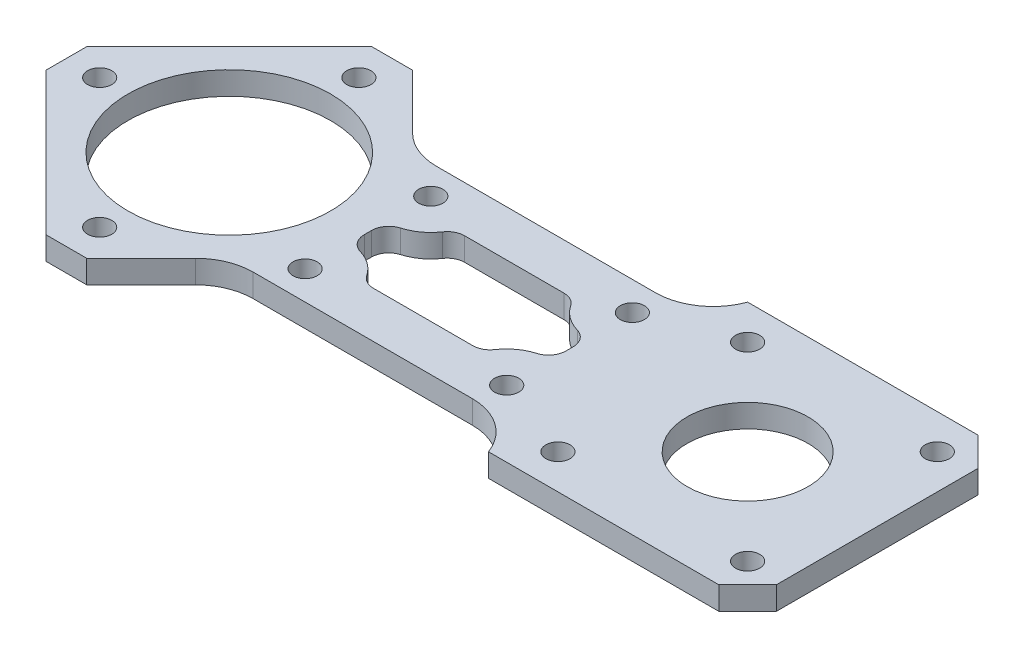
from build123d import *
from OCP.BRepFilletAPI import BRepFilletAPI_MakeChamfer

# Parameters (mm, degrees)
SKETCH_1_R          = 2.1
SKETCH_1_R_2        = 10.5
SKETCH_1_R_3        = 10
EXTRUDE_1_DEPTH     = 4
CHAMFER_1_SIZE      = 5
FILLET_1_R          = 10
SKETCH_2_R          = 2.1
CUT_EXTRUDE_1_DEPTH = 10
SKETCH_3_R          = 1.6
EXTRUDE_2_DEPTH     = 3
SKETCH_4_R          = 17.6
CUT_EXTRUDE_2_DEPTH = 10
CUT_EXTRUDE_3_DEPTH = 31.8
FILLET_6_R          = 3
FILLET_7_R          = 4
EXTRUDE_START       = -3
EXTRUDE_3_DEPTH     = 3
FILLET_8_R          = 4
CHAMFER_4_SIZE      = 15
CHAMFER_4_SIZE2     = 22.404226252
CUT_EXTRUDE_4_DEPTH = 3
FILLET_11_R         = 5
EXTRUDE_4_DEPTH     = 3
FILLET_12_R         = 5
CHAMFER_5_SIZE      = 1.5
CHAMFER_5_SIZE2     = 1.429177646
CHAMFER_5_SIZE2_2   = 1.610271544
CUT_EXTRUDE_START   = -10
CUT_EXTRUDE_5_DEPTH = 10


with BuildPart() as part:
    # 草图1 → 凸台-拉伸1 (new body)
    with BuildSketch(Plane(origin=(0, 0, 0), x_dir=(1, 0, 0), z_dir=(0, 1, 0))):
        Polygon((0, 31.819805153), (-31.819805153, 0), (0, -31.819805153), (15.909902577, -15.909902577), (67.5, -15.909902577), (67.5, -22.5), (112.5, -22.5), (112.5, 22.5), (67.5, 22.5), (67.5, 15.909902577), (15.909902577, 15.909902577), align=None)
        with Locations(Location((0, 14, 0), (0, 0, 270))):
            Circle(SKETCH_1_R, mode=Mode.SUBTRACT)
        with Locations(Location((14, 0, 0), (0, 0, 270))):
            Circle(SKETCH_1_R, mode=Mode.SUBTRACT)
        with Locations(Location((0, -14, 0), (0, 0, 270))):
            Circle(SKETCH_1_R, mode=Mode.SUBTRACT)
        with Locations(Location((-14, 0, 0), (0, 0, 270))):
            Circle(SKETCH_1_R, mode=Mode.SUBTRACT)
        with Locations(Location((90, 0, 0), (0, 0, 270))):
            Circle(SKETCH_1_R_2, mode=Mode.SUBTRACT)
        with Locations(Location((0, 22.5, 0), (0, 0, 270))):
            Circle(SKETCH_1_R, mode=Mode.SUBTRACT)
        with Locations(Location((0, -22.5, 0), (0, 0, 270))):
            Circle(SKETCH_1_R, mode=Mode.SUBTRACT)
        with Locations(Location((0, 0, 0), (0, 0, 270))):
            Circle(SKETCH_1_R_3, mode=Mode.SUBTRACT)
        with Locations(Location((-22.5, 0, 0), (0, 0, 270))):
            Circle(SKETCH_1_R, mode=Mode.SUBTRACT)
    extrude(amount=EXTRUDE_1_DEPTH)

    # 倒角1
    chamfer_1_edges = [part.edges().sort_by_distance(p)[0] for p in [
        (112.5, 2, -22.5),
        (112.5, 2, 22.5),
        (0, 2, 31.819805153),
        (-31.819805153, 2, 0),
        (0, 2, -31.819805153),
    ]]
    chamfer(chamfer_1_edges, length=CHAMFER_1_SIZE)

    # 圆角1
    # the kernel refuses this fillet: 10 mm, written as the material it adds along each edge
    with BuildSketch(Plane(origin=(15.909902577, 0, -15.909902577), x_dir=(-0.707106781186552, 0, -0.707106781186543), z_dir=(0, 1, 0))) as fillet_1_piece_1:
        with BuildLine():
            CenterArc((FILLET_1_R * 0.414213562373, -FILLET_1_R), FILLET_1_R, 90, 45)
            Line((-FILLET_1_R * 0.292893218813, -FILLET_1_R * 0.292893218813), (-FILLET_1_R * 0.307035354437, -FILLET_1_R * 0.27875108319))
            Line((-FILLET_1_R * 0.307035354437, -FILLET_1_R * 0.27875108319), (-FILLET_1_R * 0.00828427124746, FILLET_1_R * 0.02))
            Line((-FILLET_1_R * 0.00828427124746, FILLET_1_R * 0.02), (FILLET_1_R * 0.414213562373, FILLET_1_R * 0.02))
            Line((FILLET_1_R * 0.414213562373, FILLET_1_R * 0.02), (FILLET_1_R * 0.414213562373, 0))
        make_face()
    extrude(amount=4)
    with BuildSketch(Plane(origin=(15.909902577, 0, 15.909902577), x_dir=(-0.7071067811865422, 0, 0.707106781186553), z_dir=(0, 1, 0))) as fillet_1_piece_2:
        with BuildLine():
            CenterArc((FILLET_1_R * 0.414213562373, FILLET_1_R), FILLET_1_R, 225, 45)
            Line((-FILLET_1_R * 0.292893218813, FILLET_1_R * 0.292893218813), (-FILLET_1_R * 0.307035354437, FILLET_1_R * 0.27875108319))
            Line((-FILLET_1_R * 0.307035354437, FILLET_1_R * 0.27875108319), (-FILLET_1_R * 0.00828427124746, -FILLET_1_R * 0.02))
            Line((-FILLET_1_R * 0.00828427124746, -FILLET_1_R * 0.02), (FILLET_1_R * 0.414213562373, -FILLET_1_R * 0.02))
            Line((FILLET_1_R * 0.414213562373, -FILLET_1_R * 0.02), (FILLET_1_R * 0.414213562373, 0))
        make_face()
    extrude(amount=4)
    with BuildSketch(Plane(origin=(67.5, 0, 15.909902577), x_dir=(-1, 0, 0), z_dir=(0, 1, 0))) as fillet_1_piece_3:
        with BuildLine():
            CenterArc((9.400668296, 10), FILLET_1_R, 199.937217397, 70.062782603)
            Line((0, 6.590097423), (-0.188013366, 6.521899372))
            ThreePointArc((-0.188013366, 6.521899372), (-0.2, 3.295048712), (-0.2, 0))
            Line((-0.2, 0), (0, -0.2))
            Line((0, -0.2), (9.400668296, -0.2))
            Line((9.400668296, -0.2), (9.400668296, 0))
        make_face()
    extrude(amount=4)
    with BuildSketch(Plane(origin=(67.5, 0, -15.909902577), x_dir=(-1, 0, 0), z_dir=(0, 1, 0))) as fillet_1_piece_4:
        with BuildLine():
            CenterArc((9.400668296, -10), FILLET_1_R, 90, 70.062782603)
            Line((0, -6.590097423), (-0.188013366, -6.521899372))
            ThreePointArc((-0.188013366, -6.521899372), (-0.2, -3.295048712), (-0.2, 0))
            Line((-0.2, 0), (0, 0.2))
            Line((0, 0.2), (9.400668296, 0.2))
            Line((9.400668296, 0.2), (9.400668296, 0))
        make_face()
    extrude(amount=4)

    # 草图2 → 切除-拉伸1 (cut)
    with BuildSketch(Plane.XZ):
        with Locations(Location((106.464466094, 16.464466094, 0), (0, 0, 270))):
            Circle(SKETCH_2_R)
        with Locations(Location((106.464466094, -16.464466094, 0), (0, 0, 270))):
            Circle(SKETCH_2_R)
        with Locations(Location((73.535533906, -16.464466094, 0), (0, 0, 90))):
            Circle(SKETCH_2_R)
        with Locations(Location((73.535533906, 16.464466094, 0), (0, 0, 90))):
            Circle(SKETCH_2_R)
        with Locations(Location((24.075684952, 10.909902577, 0), (0, 0, 270))):
            Circle(SKETCH_2_R)
        with Locations(Location((59.075684952, 10.909902577, 0), (0, 0, 270))):
            Circle(SKETCH_2_R)
        with Locations(Location((59.075684952, -10.909902577, 0), (0, 0, 90))):
            Circle(SKETCH_2_R)
        with Locations(Location((24.075684952, -10.909902577, 0), (0, 0, 90))):
            Circle(SKETCH_2_R)
    extrude(amount=-CUT_EXTRUDE_1_DEPTH, mode=Mode.SUBTRACT)

    # 草图3 → 凸台-拉伸2 (add)
    with BuildSketch(Plane(origin=(0, 4, 0), x_dir=(1, 0, 0), z_dir=(0, 1, 0))):
        Polygon((74.689031721, 83.86671265), (39.075684952, 15.909902577), (49.236670423, 15.909902577), (78, 70.795621063), (98.581853944, 22.5), (107.5, 22.5), (81.347717681, 83.86671265), align=None)
        with Locations(Location((78, 77.942286341, 0), (0, 0, 270))):
            Circle(SKETCH_3_R, mode=Mode.SUBTRACT)
    extrude(amount=-EXTRUDE_2_DEPTH)

    # 草图4 → 切除-拉伸2 (cut)
    with BuildSketch(Plane(origin=(0, 4, 0), x_dir=(1, 0, 0), z_dir=(0, 1, 0))):
        with Locations(Location((0, 0, 0), (0, 0, 270))):
            Circle(SKETCH_4_R)
    extrude(amount=-CUT_EXTRUDE_2_DEPTH, mode=Mode.SUBTRACT)

    # 草图5 → 切除-拉伸3 (cut)
    with BuildSketch(Plane(origin=(0, 4, 0), x_dir=(1, 0, 0), z_dir=(0, 1, 0))):
        with BuildLine():
            Line((24.075684952, 3.202114308), (24.075684952, -3.202114308))
            ThreePointArc((24.075684952, -3.202114308), (28.335182293, -4.485987695), (31.175684952, -7.909902577))
            Line((31.175684952, -7.909902577), (51.975684952, -7.909902577))
            ThreePointArc((51.975684952, -7.909902577), (54.816187611, -4.485987695), (59.075684952, -3.202114308))
            Line((59.075684952, -3.202114308), (59.075684952, 3.202114308))
            ThreePointArc((59.075684952, 3.202114308), (54.816187611, 4.485987695), (51.975684952, 7.909902577))
            Line((51.975684952, 7.909902577), (31.175684952, 7.909902577))
            ThreePointArc((31.175684952, 7.909902577), (28.335182293, 4.485987695), (24.075684952, 3.202114308))
        make_face()
    extrude(amount=-CUT_EXTRUDE_3_DEPTH, mode=Mode.SUBTRACT)

    # 圆角6
    fillet_6_edges = [part.edges().sort_by_distance(p)[0] for p in [
        (24.075684952, 2, -3.202114308),
        (31.175684952, 2, -7.909902577),
        (51.975684952, 2, -7.909902577),
        (59.075684952, 2, -3.202114308),
        (59.075684952, 2, 3.202114308),
        (51.975684952, 2, 7.909902577),
        (31.175684952, 2, 7.909902577),
        (24.075684952, 2, 3.202114308),
    ]]
    fillet(fillet_6_edges, radius=FILLET_6_R)

    # 圆角7
    fillet_7_edges = [part.edges().sort_by_distance(p)[0] for p in [
        (49.236670423, 2.5, -15.909902577),
    ]]
    fillet(fillet_7_edges, radius=FILLET_7_R)

    # 草图6 → 凸台-拉伸3 (add)
    with BuildSketch(Plane(origin=(0, 4, 0), x_dir=(1, 0, 0), z_dir=(0, 1, 0)).offset(EXTRUDE_START)):
        with BuildLine():
            Line((67.5, 22.5), (52.690267267, 22.5))
            Line((52.690267267, 22.5), (52.305934696, 21.766622828))
            ThreePointArc((52.305934696, 21.766622828), (52.426407737, 17.83950177), (55.848898132, 15.909902577))
            Line((55.848898132, 15.909902577), (58.099331704, 15.909902577))
            ThreePointArc((58.099331704, 15.909902577), (63.839583189, 17.721525883), (67.5, 22.5))
        make_face()
    extrude(amount=EXTRUDE_3_DEPTH)

    # 圆角8
    fillet_8_edges = [part.edges().sort_by_distance(p)[0] for p in [
        (98.581853944, 2.5, -22.5),
        (78, 2.5, -70.795621063),
        (52.690267267, 2.5, -22.5),
    ]]
    fillet(fillet_8_edges, radius=FILLET_8_R)

    # 倒角4
    chamfer_4_edges = [part.edges().sort_by_distance(p)[0] for p in [
        (39.075684952, 2.5, -15.909902577),
    ]]
    chamfer_4_side = [part.faces().sort_by_distance(p)[0] for p in [
        (33.368590927, 1.7, -15.909902577),
    ]]
    chamfer(chamfer_4_edges, length=CHAMFER_4_SIZE, length2=CHAMFER_4_SIZE2, reference=chamfer_4_side[0])

    # 草图7 → 切除-拉伸4 (cut)
    with BuildSketch(Plane(origin=(0, 4, 0), x_dir=(1, 0, 0), z_dir=(0, 1, 0))):
        with BuildLine():
            Line((32.197031179, 15.909902577), (56.151580128, 15.909902577))
            Line((56.151580128, 15.909902577), (59.302494975, 17.5))
            ThreePointArc((59.302494975, 17.5), (51.509584112, 21.997718325), (51.505632804, 30.995435494))
            Line((51.505632804, 30.995435494), (32.197031179, 15.909902577))
        make_face()
    extrude(amount=-CUT_EXTRUDE_4_DEPTH, mode=Mode.SUBTRACT)

    # 圆角11
    fillet_11_edges = [part.edges().sort_by_distance(p)[0] for p in [
        (49.475280099, 2.5, -35.754241184),
        (24.075684952, 2.5, -15.909902577),
    ]]
    fillet(fillet_11_edges, radius=FILLET_11_R)

    # 草图8 → 凸台-拉伸4 (add)
    with BuildSketch(Plane(origin=(0, 4, 0), x_dir=(1, 0, 0), z_dir=(0, 1, 0))):
        Polygon((81.347717681, 83.86671265), (83.347717681, 83.86671265), (85.253411001, 74.701946198), align=None)
        Polygon((74.689031721, 83.86671265), (72.689031721, 83.86671265), (69.886157582, 74.701946198), align=None)
    extrude(amount=-EXTRUDE_4_DEPTH)

    # 圆角12
    fillet_12_edges = [part.edges().sort_by_distance(p)[0] for p in [
        (85.253411001, 2.5, -74.701946198),
        (69.886157582, 2.5, -74.701946198),
    ]]
    fillet(fillet_12_edges, radius=FILLET_12_R)

    # 倒角5: one chamfer whose edges measure the first distance from different faces: ONE call of the kernel's chamfer builder (chamfer() names one face for all edges)
    chamfer_5_edges_1 = [part.edges().sort_by_distance(p)[0] for p in [
        (83.347717681, 2.5, -83.86671265),
    ]]
    chamfer_5_side_1 = [part.faces().sort_by_distance(p)[0] for p in [
        (78.018374701, 2.5, -83.86671265),
    ]]
    chamfer_5_edges_2 = [part.edges().sort_by_distance(p)[0] for p in [
        (72.689031721, 2.5, -83.86671265),
    ]]
    chamfer_5_side_2 = [part.faces().sort_by_distance(p)[0] for p in [
        (71.355755289, 2.5, -79.50719934),
    ]]
    chamfer_5 = BRepFilletAPI_MakeChamfer(part.part.solid().wrapped)
    for e in chamfer_5_edges_1:
        chamfer_5.Add(CHAMFER_5_SIZE, CHAMFER_5_SIZE2, e.wrapped, chamfer_5_side_1[0].wrapped)  # the first distance lies on this face
    for e in chamfer_5_edges_2:
        chamfer_5.Add(CHAMFER_5_SIZE, CHAMFER_5_SIZE2_2, e.wrapped, chamfer_5_side_2[0].wrapped)  # the first distance lies on this face
    add(Compound.cast(chamfer_5.Shape()), mode=Mode.REPLACE)

    # 草图9 → 切除-拉伸5 (cut)
    with BuildSketch(Plane(origin=(0, 4, 0), x_dir=(1, 0, 0), z_dir=(0, 1, 0)).offset(CUT_EXTRUDE_START)):
        with BuildLine():
            Line((22.354046886, 15.909902577), (58.099331704, 15.909902577))
            ThreePointArc((58.099331704, 15.909902577), (63.839583189, 17.721525883), (67.5, 22.5))
            Line((67.5, 22.5), (112.713100818, 22.5))
            Line((112.713100818, 22.5), (128.205404221, 15.909902577))
            Line((128.205404221, 15.909902577), (92.949872776, 93.149070556))
            Line((92.949872776, 93.149070556), (54.968117123, 93.149070556))
            Line((54.968117123, 93.149070556), (22.354046886, 15.909902577))
        make_face()
    extrude(amount=CUT_EXTRUDE_5_DEPTH, mode=Mode.SUBTRACT)


solid = part.part
